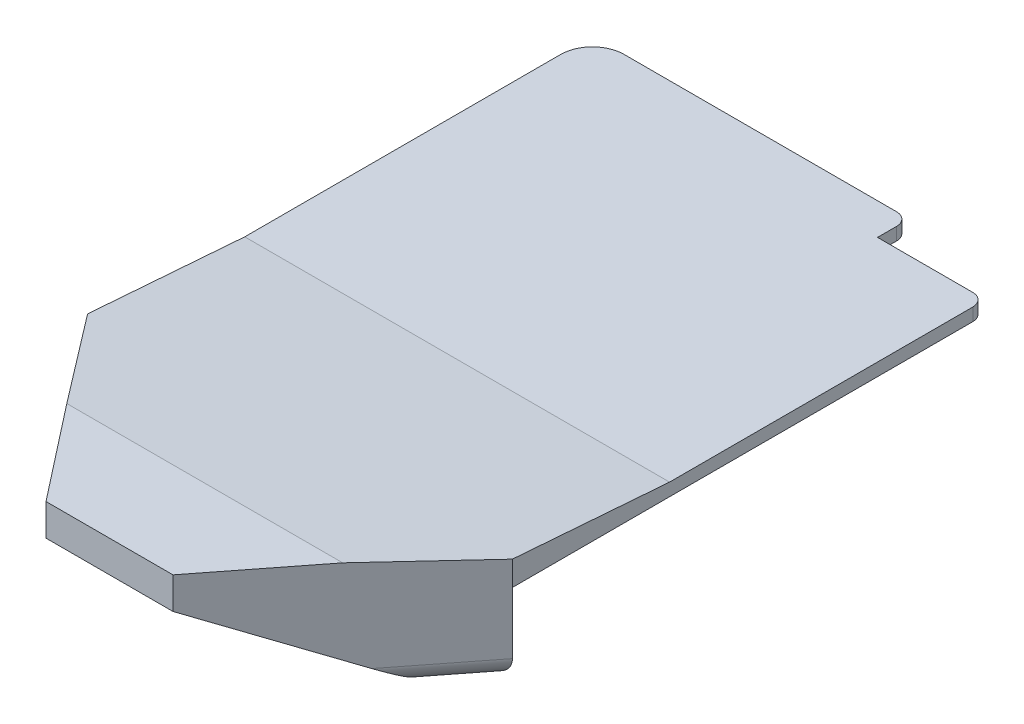
from build123d import *

# Parameters (mm, degrees)
BOSS_EXTRUDE1_DEPTH     = 7.7
SKETCH2_W               = 7
SKETCH2_H               = 3.1
CUT_EXTRUDE1_DEPTH      = 79.027559234
FILLET1_R               = 10
BOSS_EXTRUDE2_DEPTH     = 2
BOSS_EXTRUDE3_DEPTH     = 33.45
BOSS_EXTRUDE4_REACH     = 112.929
CUT_EXTRUDE2_DEPTH      = 111.928772192
CUT_EXTRUDE2_DEPTH_BACK = 111.928772192
CUT_EXTRUDE3_DEPTH      = 10
FILLET3_R               = 1
FILLET5_R               = 3
SKETCH8_W               = 17
SKETCH8_H               = 5
CUT_EXTRUDE4_DEPTH      = 2
FILLET6_R               = 5
FILLET7_R               = 2


with BuildPart() as part:
    # Sketch1 → Boss-Extrude1 (new body)
    with BuildSketch(Plane(origin=(0, 0, 0), x_dir=(1, 0, 0), z_dir=(0, 1, 0))):
        Polygon((0, 0), (-16.35, 0), (-16.35, -9.85), (-2.6, -9.85), (-2.6, -33), (-20.1, -33), (-20.1, -75), (0, -75), align=None)
    extrude(amount=BOSS_EXTRUDE1_DEPTH)

    # Sketch2 → Cut-Extrude1 (cut, through all)
    with BuildSketch(Plane.XY.offset(75)):
        with Locations((-16.6, 3.55)):
            Rectangle(SKETCH2_W, SKETCH2_H)
    extrude(amount=-CUT_EXTRUDE1_DEPTH, mode=Mode.SUBTRACT)

    # Fillet1
    fillet1_edges = [part.edges().sort_by_distance(p)[0] for p in [
        (-2.6, 3.85, 33),
    ]]
    fillet(fillet1_edges, radius=FILLET1_R)

    # Sketch3 → Boss-Extrude2 (add)
    with BuildSketch(Plane(origin=(0, 7.7, 0), x_dir=(1, 0, 0), z_dir=(0, 1, 0))):
        Polygon((0, 4.5), (-33.45, 4.5), (-33.45, -75), (-10, -105), (0, -105), align=None)
    extrude(amount=BOSS_EXTRUDE2_DEPTH)

    # Sketch4 → Boss-Extrude3 (add)
    with BuildSketch(Plane(origin=(0, 0, 0), x_dir=(0, 0, -1), z_dir=(1, 0, 0))):
        Polygon((-105, 9.7), (-105, 12.7), (-90, 12.7), (-50.25, 9.7), align=None)
    extrude(amount=-BOSS_EXTRUDE3_DEPTH)

    # Boss-Extrude4: up to this face of the body (flat: up to its plane)
    boss_extrude4_end = Plane(part.part.faces().sort_by_distance((0, 5.848980441, 46.191947566))[0])
    # Sketch5 → Boss-Extrude4 (add, up to the picked face)
    with BuildSketch(Plane.ZY.offset(33.45), mode=Mode.PRIVATE) as boss_extrude4_sk1:
        Polygon((75, 7.7), (75, -5), (82, -5), (105, 7.7), align=None)
    boss_extrude4_tool1 = split(extrude(boss_extrude4_sk1.sketch, amount=-BOSS_EXTRUDE4_REACH, mode=Mode.PRIVATE), bisect_by=boss_extrude4_end, keep=Keep.BOTH, mode=Mode.PRIVATE)
    add(boss_extrude4_tool1.solids().sort_by(Axis((-33.45, 2.665766, 85.441441), (1, 0, 0)))[0])

    # Sketch6 → Cut-Extrude2 (cut, two sides: drawn at the far end of the back side and taken through both)
    with BuildSketch(Plane(origin=(0, 7.7, 0), x_dir=(1, 0, 0), z_dir=(0, 1, 0)).offset(-CUT_EXTRUDE2_DEPTH_BACK)):
        Polygon((-33.45, -75), (-10, -105), (-33.45, -105), align=None)
    extrude(amount=CUT_EXTRUDE2_DEPTH + CUT_EXTRUDE2_DEPTH_BACK, mode=Mode.SUBTRACT)

    # Sketch7 → Cut-Extrude3 (cut)
    with BuildSketch(Plane(origin=(0, 0, 0), x_dir=(0, 0, -1), z_dir=(1, 0, 0))):
        Polygon((-75, 0), (-85, 0), (-80, -5), (-75, -5), align=None)
    extrude(amount=-CUT_EXTRUDE3_DEPTH, mode=Mode.SUBTRACT)

    # Fillet3
    # the kernel refuses this fillet: 1 mm, written as the material it takes off along each edge
    with BuildSketch(Plane(origin=(5.810983209, -5, 80), x_dir=(0, 0, 1), z_dir=(-1, 0, 0))) as fillet3_piece_1:
        with BuildLine():
            CenterArc((2.350701034, 0.936487472), FILLET3_R, 135, 114.469800521)
            Line((1.643594253, 1.643594253), (1.629452117, 1.657736389))
            Line((1.629452117, 1.657736389), (-0.014142136, 0.014142136))
            Line((-0.014142136, 0.014142136), (0, -0.02))
            ThreePointArc((0, -0.02), (1, -0.02), (1.992985979, -0.018729749))
            Line((1.992985979, -0.018729749), (2, 0))
        make_face()
    extrude(amount=15.810983209, mode=Mode.SUBTRACT)
    with BuildSketch(Plane(origin=(-10, -5, 82.5), x_dir=(-1, 0, 0), z_dir=(0, 0, -1))) as fillet3_piece_2_section:
        with BuildLine():
            CenterArc((FILLET3_R, FILLET3_R), FILLET3_R, 180, 90)
            Line((0, FILLET3_R), (-FILLET3_R * 0.02, FILLET3_R))
            Line((-FILLET3_R * 0.02, FILLET3_R), (-FILLET3_R * 0.02, -FILLET3_R * 0.02))
            Line((-FILLET3_R * 0.02, -FILLET3_R * 0.02), (FILLET3_R, -FILLET3_R * 0.02))
            Line((FILLET3_R, -FILLET3_R * 0.02), (FILLET3_R, 0))
        make_face()
    fillet3_piece_2 = extrude(amount=10, mode=Mode.PRIVATE)
    fillet3_piece_2 = split(fillet3_piece_2, bisect_by=Plane(origin=(-10.222841489, -6.700692184, 78.299307816), z_dir=(0, 0.7071067811865466, -0.7071067811865485)), keep=Keep.TOP, mode=Mode.PRIVATE)
    add(fillet3_piece_2, mode=Mode.SUBTRACT)
    with BuildSketch(Plane(origin=(5.810983209, -5, 80), x_dir=(0, 0, 1), z_dir=(-1, 0, 0))) as fillet3_piece_3a_section:
        with BuildLine():
            CenterArc((2.350701034, 0.936487472), FILLET3_R, 135, 114.469800521)
            Line((1.643594253, 1.643594253), (1.629452117, 1.657736389))
            Line((1.629452117, 1.657736389), (-0.014142136, 0.014142136))
            Line((-0.014142136, 0.014142136), (0, -0.02))
            ThreePointArc((0, -0.02), (1, -0.02), (1.992985979, -0.018729749))
            Line((1.992985979, -0.018729749), (2, 0))
        make_face()
    fillet3_piece_3a = extrude(amount=21.621966417, mode=Mode.PRIVATE)
    fillet3_piece_3a = split(fillet3_piece_3a, bisect_by=Plane(origin=(-10, -4.567151235, 80.996776665), z_dir=(-1, 0, 0)), keep=Keep.TOP, mode=Mode.PRIVATE)
    with BuildSketch(Plane(origin=(-10, -5, 82.5), x_dir=(-1, 0, 0), z_dir=(0, 0, -1))) as fillet3_piece_3b_section:
        with BuildLine():
            CenterArc((FILLET3_R, FILLET3_R), FILLET3_R, 180, 90)
            Line((0, FILLET3_R), (-FILLET3_R * 0.02, FILLET3_R))
            Line((-FILLET3_R * 0.02, FILLET3_R), (-FILLET3_R * 0.02, -FILLET3_R * 0.02))
            Line((-FILLET3_R * 0.02, -FILLET3_R * 0.02), (FILLET3_R, -FILLET3_R * 0.02))
            Line((FILLET3_R, -FILLET3_R * 0.02), (FILLET3_R, 0))
        make_face()
    fillet3_piece_3b = extrude(amount=10, mode=Mode.PRIVATE)
    fillet3_piece_3b = split(fillet3_piece_3b, bisect_by=Plane(origin=(-10.238471404, -4.220535034, 80.779464966), z_dir=(0, -0.7071067811865466, 0.7071067811865485)), keep=Keep.TOP, mode=Mode.PRIVATE)
    fillet3_piece_3 = fillet3_piece_3a & fillet3_piece_3b
    add(fillet3_piece_3, mode=Mode.SUBTRACT)

    # Mirror1: part across plane


with BuildPart() as part_1:
    add(part.part)
    add(part.part.mirror(Plane(origin=(0, 7.7, 75), x_dir=(0, 0, 1), z_dir=(-1, 0, 0))))

    # Fillet5
    # the kernel refuses this fillet: 3 mm, written as the material it takes off along each edge
    with BuildSketch(Plane(origin=(-38.068859068, -5, 69.091011854), x_dir=(0, 1, 0), z_dir=(0.6158478756904763, 0, 0.7878650861711843)), Plane(origin=(38.068859068, -5, 69.091011854), x_dir=(-0.7878650861711843, 0, -0.6158478756904764), z_dir=(-0.6158478756904763, 0, 0.7878650861711843))) as fillet5_piece_1:
        with BuildLine():
            CenterArc((FILLET5_R, -FILLET5_R), FILLET5_R, 90, 90)
            Line((0, -FILLET5_R), (0, 0))
            Line((0, 0), (FILLET5_R, 0))
        make_face()
    extrude(amount=23.884769896, mode=Mode.SUBTRACT)

    # Sketch8 → Cut-Extrude4 (cut)
    with BuildSketch(Plane(origin=(0, 9.7, 0), x_dir=(1, 0, 0), z_dir=(0, 1, 0))):
        with Locations((24.95, 2)):
            Rectangle(SKETCH8_W, SKETCH8_H)
    extrude(amount=-CUT_EXTRUDE4_DEPTH, mode=Mode.SUBTRACT)

    # Fillet6
    fillet6_edges = [part_1.edges().sort_by_distance(p)[0] for p in [
        (-33.45, 8.7, -4.5),
    ]]
    fillet(fillet6_edges, radius=FILLET6_R)

    # Fillet7
    fillet7_edges = [part_1.edges().sort_by_distance(p)[0] for p in [
        (16.45, 8.7, -4.5),
        (33.45, 8.7, 0.5),
    ]]
    fillet(fillet7_edges, radius=FILLET7_R)


solid = part_1.part
